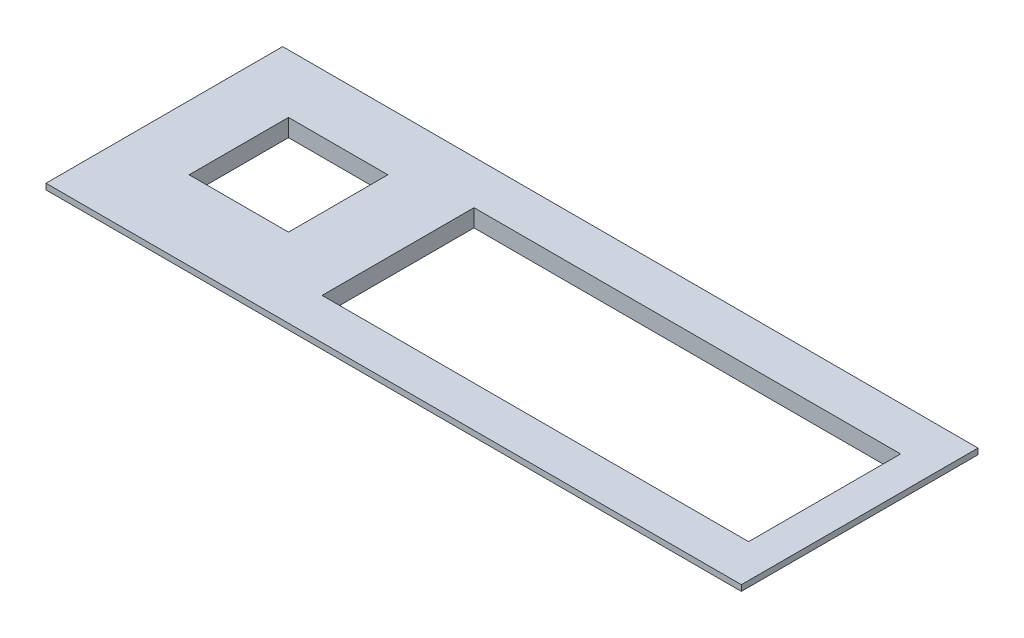
from build123d import *

# Parameters (mm, degrees)
SKETCH1_W                = 115
SKETCH1_H                = 36.5
BOSS_EXTRUDE1_DEPTH      = 1
BOSS_EXTRUDE2_DEPTH      = 20
BOSS_EXTRUDE2_DEPTH_BACK = 1
SKETCH2_W                = 119
SKETCH2_H                = 40.5
SKETCH2_W_2              = 115
SKETCH2_H_2              = 36.5
SKETCH3_R                = 1.5
SKETCH3_W                = 6
SKETCH3_H                = 6
BOSS_EXTRUDE3_DEPTH      = 3
SKETCH4_R                = 1.5
SKETCH4_W                = 5.5
SKETCH4_H                = 6.495155074
BOSS_EXTRUDE4_DEPTH      = 8
SKETCH5_W                = 15
SKETCH5_H                = 10
CUT_EXTRUDE1_DEPTH       = 8
SKETCH6_W                = 46
SKETCH6_H                = 7.792677535
CUT_EXTRUDE2_DEPTH       = 8
SKETCH7_W                = 10.3
SKETCH7_H                = 10.3
CUT_EXTRUDE3_DEPTH       = 8
SKETCH8_W                = 15
SKETCH8_H                = 5
CUT_EXTRUDE4_DEPTH       = 8
SKETCH9_W                = 119
SKETCH9_H                = 40.5
SKETCH9_W_2              = 17
SKETCH9_H_2              = 17
SKETCH9_W_3              = 73
SKETCH9_H_3              = 26
BOSS_EXTRUDE5_DEPTH      = 3
SKETCH10_W               = 119
SKETCH10_H               = 40.5
SKETCH10_W_2             = 115
SKETCH10_H_2             = 36.5
CUT_EXTRUDE5_DEPTH       = 2


with BuildPart() as part:
    # Sketch1 → Boss-Extrude1 (new body)
    with BuildSketch(Plane(origin=(0, 0, 0), x_dir=(1, 0, 0), z_dir=(0, 1, 0))):
        Rectangle(SKETCH1_W, SKETCH1_H)
    extrude(amount=BOSS_EXTRUDE1_DEPTH)


with BuildPart() as body_2:
    # Sketch2 → Boss-Extrude2 (new, two sides: drawn at the far end of the back side and taken through both)
    with BuildSketch(Plane(origin=(0, 1, 0), x_dir=(1, 0, 0), z_dir=(0, 1, 0)).offset(-BOSS_EXTRUDE2_DEPTH_BACK)):
        Rectangle(SKETCH2_W, SKETCH2_H)
        Rectangle(SKETCH2_W_2, SKETCH2_H_2, mode=Mode.SUBTRACT)
    extrude(amount=BOSS_EXTRUDE2_DEPTH + BOSS_EXTRUDE2_DEPTH_BACK)

    # Intersect1: read off the stored shape, not the designer's step
    # Intersect1: union part
    add(part.part)

    # Sketch3 → Boss-Extrude3 (add)
    # profile 1 of 4: a face of its own
    with BuildSketch(Plane(origin=(0, 1, 0), x_dir=(1, 0, 0), z_dir=(0, 1, 0))):
        Polygon((-51.5, 7.25), (-51.5, 13.25), (-54, 13.25), (-57.5, 13.25), (-57.5, 9.75), (-57.5, 7.25), align=None)
        with Locations(Location((-54, 9.75, 0), (0, 0, 270))):
            Circle(SKETCH3_R, mode=Mode.SUBTRACT)
    # profile 2 of 4: a face of its own
    with BuildSketch(Plane(origin=(0, 1, 0), x_dir=(1, 0, 0), z_dir=(0, 1, 0))):
        with Locations((-25.5, 10.25)):
            Rectangle(SKETCH3_W, SKETCH3_H)
        with Locations(Location((-26, 9.75, 0), (0, 0, 90))):
            Circle(SKETCH3_R, mode=Mode.SUBTRACT)
    # profile 3 of 4: a face of its own
    with BuildSketch(Plane(origin=(0, 1, 0), x_dir=(1, 0, 0), z_dir=(0, 1, 0))):
        with Locations((-25.5, -10.25)):
            Rectangle(SKETCH3_W, SKETCH3_H)
        with Locations(Location((-26, -9.75, 0), (0, 0, 270))):
            Circle(SKETCH3_R, mode=Mode.SUBTRACT)
    # profile 4 of 4: a face of its own
    with BuildSketch(Plane(origin=(0, 1, 0), x_dir=(1, 0, 0), z_dir=(0, 1, 0))):
        with Locations((-54.5, -10.25)):
            Rectangle(SKETCH3_W, SKETCH3_H)
        with Locations(Location((-54, -9.75, 0), (0, 0, 90))):
            Circle(SKETCH3_R, mode=Mode.SUBTRACT)
    extrude(amount=BOSS_EXTRUDE3_DEPTH)

    # Sketch4 → Boss-Extrude4 (add)
    # profile 1 of 4: a face of its own
    with BuildSketch(Plane(origin=(0, 1, 0), x_dir=(1, 0, 0), z_dir=(0, 1, 0))):
        Polygon((-22.5, 13.25), (-22.5, 11.754844926), (-17, 11.754844926), (-17, 18.25), (-20, 18.25), (-22.5, 18.25), (-22.5, 15.25), align=None)
        with Locations(Location((-20, 15.25, 0), (0, 0, 270))):
            Circle(SKETCH4_R, mode=Mode.SUBTRACT)
    # profile 2 of 4: a face of its own
    with BuildSketch(Plane(origin=(0, 1, 0), x_dir=(1, 0, 0), z_dir=(0, 1, 0))):
        with Locations((-19.75, -15.002422463)):
            Rectangle(SKETCH4_W, SKETCH4_H)
        with Locations(Location((-20, -15.25, 0), (0, 0, 90))):
            Circle(SKETCH4_R, mode=Mode.SUBTRACT)
    # profile 3 of 4: a face of its own
    with BuildSketch(Plane(origin=(0, 1, 0), x_dir=(1, 0, 0), z_dir=(0, 1, 0))):
        with Locations((54.75, -15.002422463)):
            Rectangle(SKETCH4_W, SKETCH4_H)
        with Locations(Location((55, -15.25, 0), (0, 0, 270))):
            Circle(SKETCH4_R, mode=Mode.SUBTRACT)
    # profile 4 of 4: a face of its own
    with BuildSketch(Plane(origin=(0, 1, 0), x_dir=(1, 0, 0), z_dir=(0, 1, 0))):
        with Locations((54.75, 15.002422463)):
            Rectangle(SKETCH4_W, SKETCH4_H)
        with Locations(Location((55, 15.25, 0), (0, 0, 90))):
            Circle(SKETCH4_R, mode=Mode.SUBTRACT)
    extrude(amount=BOSS_EXTRUDE4_DEPTH)

    # Sketch5 → Cut-Extrude1 (cut)
    with BuildSketch(Plane.ZY.offset(59.5)):
        with Locations((0, 11.525411997)):
            Rectangle(SKETCH5_W, SKETCH5_H)
    extrude(amount=-CUT_EXTRUDE1_DEPTH, mode=Mode.SUBTRACT)

    # Sketch6 → Cut-Extrude2 (cut)
    with BuildSketch(Plane(origin=(0, 0, -20.25), x_dir=(-1, 0, 0), z_dir=(0, 0, -1))):
        with Locations((-6.5, 11.396338768)):
            Rectangle(SKETCH6_W, SKETCH6_H)
    extrude(amount=-CUT_EXTRUDE2_DEPTH, mode=Mode.SUBTRACT)

    # Sketch7 → Cut-Extrude3 (cut)
    with BuildSketch(Plane.XY.offset(20.25)):
        with Locations((-49.05, 10.55)):
            Rectangle(SKETCH7_W, SKETCH7_H)
    extrude(amount=-CUT_EXTRUDE3_DEPTH, mode=Mode.SUBTRACT)

    # Sketch8 → Cut-Extrude4 (cut)
    with BuildSketch(Plane(origin=(0, 0, -20.25), x_dir=(-1, 0, 0), z_dir=(0, 0, -1))):
        with Locations((40.794043984, 3.5)):
            Rectangle(SKETCH8_W, SKETCH8_H)
    extrude(amount=-CUT_EXTRUDE4_DEPTH, mode=Mode.SUBTRACT)


with BuildPart() as body_2_2:
    # Sketch9 → Boss-Extrude5 (new body)
    with BuildSketch(Plane(origin=(0, 21, 0), x_dir=(1, 0, 0), z_dir=(0, 1, 0))):
        Rectangle(SKETCH9_W, SKETCH9_H)
        with Locations((-40, 1.75)):
            Rectangle(SKETCH9_W_2, SKETCH9_H_2, mode=Mode.SUBTRACT)
        with Locations((17.25, -0.25)):
            Rectangle(SKETCH9_W_3, SKETCH9_H_3, mode=Mode.SUBTRACT)
    extrude(amount=BOSS_EXTRUDE5_DEPTH)

    # Sketch10 → Cut-Extrude5 (cut)
    with BuildSketch(Plane.XZ.offset(-21)):
        Rectangle(SKETCH10_W, SKETCH10_H)
        Rectangle(SKETCH10_W_2, SKETCH10_H_2, mode=Mode.SUBTRACT)
    extrude(amount=-CUT_EXTRUDE5_DEPTH, mode=Mode.SUBTRACT)


solid = body_2_2.part
